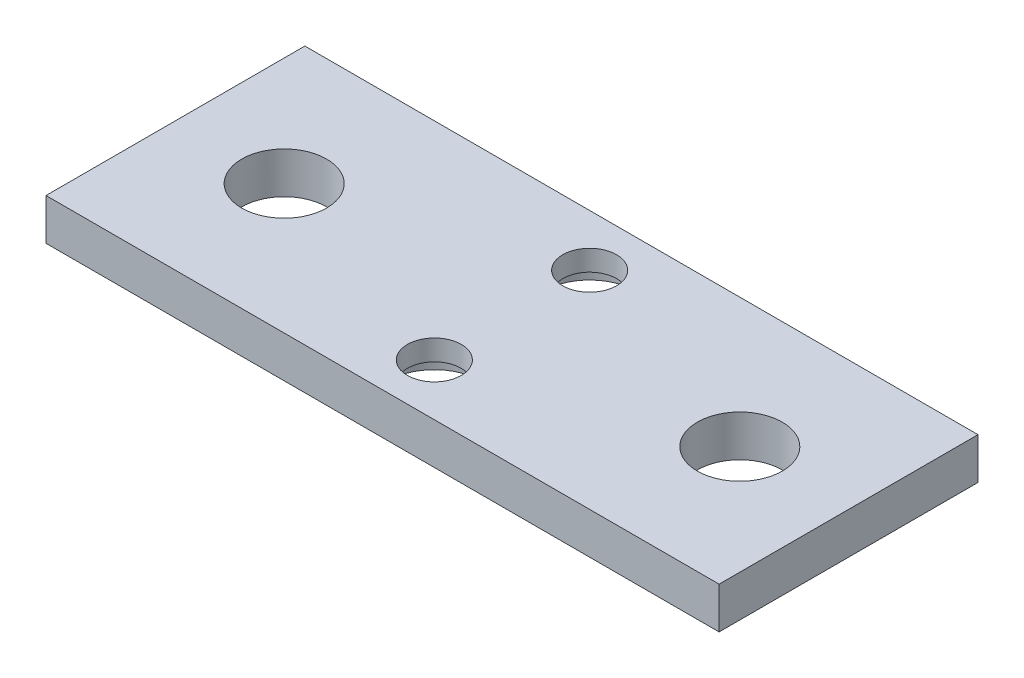
from build123d import *

# Parameters (mm, degrees)
SKETCH_1_W          = 65
SKETCH_1_H          = 25
EXTRUDE_1_DEPTH     = 4
SKETCH_2_W          = 15
SKETCH_2_H          = 25
EXTRUDE_2_DEPTH     = 13
SKETCH_3_R          = 2.6
SKETCH_3_R_2        = 4.1
CUT_EXTRUDE_1_DEPTH = 39.74919354
SKETCH_4_R          = 4.5
CUT_EXTRUDE_2_DEPTH = 2
SKETCH_5_W          = 15
SKETCH_5_H          = 4
EXTRUDE_3_DEPTH     = 6
SKETCH_6_R          = 1.25
CUT_EXTRUDE_3_DEPTH = 40.59166579
FILLET_2_R          = 3
SKETCH_9_W          = 15
SKETCH_9_H          = 13
CUT_EXTRUDE_4_DEPTH = 53.098464469


with BuildPart() as part:
    # 草图1 → 凸台-拉伸1 (new body)
    with BuildSketch(Plane(origin=(0, 0, 0), x_dir=(1, 0, 0), z_dir=(0, 1, 0))):
        Rectangle(SKETCH_1_W, SKETCH_1_H)
    extrude(amount=EXTRUDE_1_DEPTH)

    # 草图2 → 凸台-拉伸2 (add)
    with BuildSketch(Plane(origin=(0, 4, 0), x_dir=(1, 0, 0), z_dir=(0, 1, 0))):
        Rectangle(SKETCH_2_W, SKETCH_2_H)
    extrude(amount=EXTRUDE_2_DEPTH)

    # 草图3 → 切除-拉伸1 (cut, through all)
    with BuildSketch(Plane.XZ):
        with Locations((0, -7.5)):
            Circle(SKETCH_3_R)
        with Locations((0, 7.5)):
            Circle(SKETCH_3_R)
        with Locations((-22, 0)):
            Circle(SKETCH_3_R_2)
        with Locations((22, 0)):
            Circle(SKETCH_3_R_2)
    extrude(amount=-CUT_EXTRUDE_1_DEPTH, mode=Mode.SUBTRACT)

    # 草图4 → 切除-拉伸2 (cut)
    with BuildSketch(Plane.XZ):
        with Locations((0, -7.5)):
            Circle(SKETCH_4_R)
        with Locations((0, 7.5)):
            Circle(SKETCH_4_R)
    extrude(amount=-CUT_EXTRUDE_2_DEPTH, mode=Mode.SUBTRACT)

    # 草图5 → 凸台-拉伸3 (add)
    with BuildSketch(Plane.XY.offset(12.5)):
        with Locations((0, 6)):
            Rectangle(SKETCH_5_W, SKETCH_5_H)
    extrude_3 = extrude(amount=EXTRUDE_3_DEPTH)

    # 草图6 → 切除-拉伸3 (cut, through all)
    with BuildSketch(Plane.XZ.offset(-4)):
        with Locations((-4.5, 15.5)):
            Circle(SKETCH_6_R)
        with Locations((4.5, 15.5)):
            Circle(SKETCH_6_R)
    cut_extrude_3 = extrude(amount=-CUT_EXTRUDE_3_DEPTH, mode=Mode.SUBTRACT)

    # 镜向2: 凸台-拉伸3, 切除-拉伸3 across plane
    add(extrude_3.mirror(Plane.XY))
    add(cut_extrude_3.mirror(Plane.XY), mode=Mode.SUBTRACT)

    # 圆角2
    fillet_2_edges = [part.edges().sort_by_distance(p)[0] for p in [
        (-7.5, 6, -18.5),
        (7.5, 6, -18.5),
        (-7.5, 6, 18.5),
        (7.5, 6, 18.5),
    ]]
    fillet(fillet_2_edges, radius=FILLET_2_R)

    # 草图9 → 切除-拉伸4 (cut, through all)
    with BuildSketch(Plane.XY.offset(18.5)):
        with Locations((0, 10.5)):
            Rectangle(SKETCH_9_W, SKETCH_9_H)
    extrude(amount=-CUT_EXTRUDE_4_DEPTH, mode=Mode.SUBTRACT)


solid = part.part
